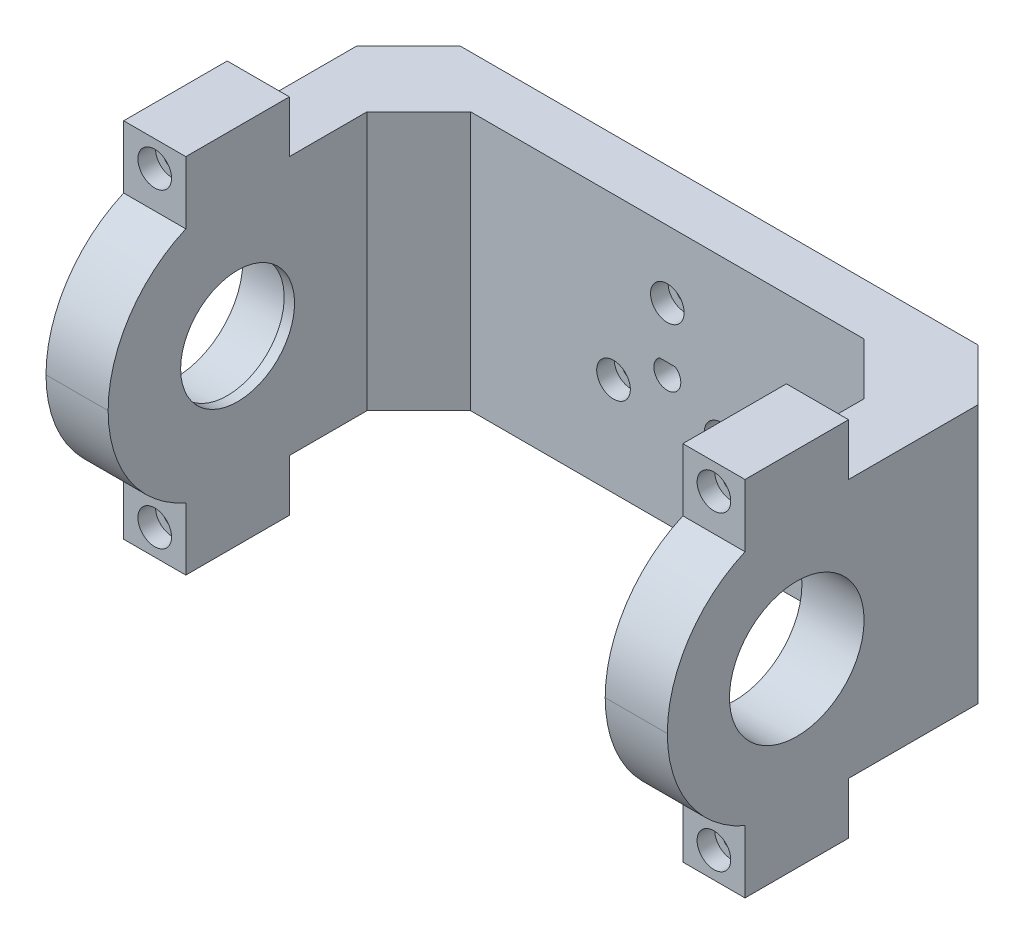
from build123d import *

# Parameters (mm, degrees)
AUFSATZ_LINEAR_AUSTRAGEN1_DEPTH            = 25
SCHNITT_LINEAR_AUSTRAGEN1_DEPTH            = 20
FASE1_SIZE                                 = 10
VERRUNDUNG1_R                              = 25
SKIZZE3_R                                  = 3.25
SCHNITT_LINEAR_AUSTRAGEN2_DEPTH            = 3.4
SKIZZE4_R                                  = 1.7
SCHNITT_LINEAR_AUSTRAGEN3_DEPTH            = 6.6
KREISMUSTER1_COUNT                         = 3
SKIZZE5_R                                  = 13
SCHNITT_LINEAR_AUSTRAGEN4_DEPTH            = 142.155942135
SKIZZE7_W                                  = 12
SKIZZE7_H                                  = 20
AUFSATZ_LINEAR_AUSTRAGEN2_DEPTH            = 10
SKIZZE9_R                                  = 1.7
SCHNITT_LINEAR_AUSTRAGEN7_DEPTH            = 78.781745931
SKIZZE8_R                                  = 3.25
SCHNITT_LINEAR_AUSTRAGEN6_DEPTH            = 3.4
SKIZZE10_R                                 = 13
SKIZZE10_R_2                               = 11
AUFSATZ_LINEAR_AUSTRAGEN3_DEPTH            = 2
SPIEGELN1_AT_THE_SECOND_PLANE_COPY_1_SKE_W = 12
SPIEGELN1_AT_THE_SECOND_PLANE_COPY_1_SKE_H = 20
SPIEGELN1_AT_THE_SECOND_PLANE_COPY_1_DEPTH = 10
SPIEGELN1_AT_THE_SECOND_PLANE_COPY_2_SKE_R = 1.7
SPIEGELN1_AT_THE_SECOND_PLANE_COPY_2_DEPTH = 78.781745931
SPIEGELN1_AT_THE_SECOND_PLANE_COPY_3_SKE_R = 3.25
SPIEGELN1_AT_THE_SECOND_PLANE_COPY_3_DEPTH = 3.4
SKIZZE11_R                                 = 1.9
SCHNITT_LINEAR_AUSTRAGEN8_DEPTH            = 10
KREISMUSTER2_COUNT                         = 4


with BuildPart() as part:
    # Skizze1 → Aufsatz-Linear austragen1 (new, symmetric)
    with BuildSketch(Plane(origin=(0, 0, 0), x_dir=(1, 0, 0), z_dir=(0, 1, 0))):
        Polygon((-60, 0), (60, 0), (60, -70), (48, -70), (48, -10), (-48, -10), (-48, -70), (-60, -70), align=None)
    extrude(amount=AUFSATZ_LINEAR_AUSTRAGEN1_DEPTH, both=True)

    # Skizze2 → Schnitt-Linear austragen1 (cut)
    with BuildSketch(Plane(origin=(0, 0, 0), x_dir=(-1, 0, 0), z_dir=(0, 0, -1))):
        with BuildLine():
            Line((-1.532970972, 2.1), (1.532970972, 2.1))
            ThreePointArc((1.532970972, 2.1), (0, -2.6), (-1.532970972, 2.1))
        make_face()
    extrude(amount=-SCHNITT_LINEAR_AUSTRAGEN1_DEPTH, mode=Mode.SUBTRACT)

    # Fase1
    fase1_edges = [part.edges().sort_by_distance(p)[0] for p in [
        (-60, 0, 0),
        (60, 0, 0),
        (48, 0, 10),
        (-48, 0, 10),
    ]]
    chamfer(fase1_edges, length=FASE1_SIZE)

    # Verrundung1
    verrundung1_edges = [part.edges().sort_by_distance(p)[0] for p in [
        (-54, -25, 70),
        (-54, 25, 70),
        (54, 25, 70),
        (54, -25, 70),
    ]]
    fillet(verrundung1_edges, radius=VERRUNDUNG1_R - 0.0001)  # a hair under: the kernel refuses the full size

    # Skizze3 → Schnitt-Linear austragen2 (cut)
    with BuildSketch(Plane.XY.offset(10)):
        with Locations((0, 12)):
            Circle(SKIZZE3_R)
    schnitt_linear_austragen2 = extrude(amount=-SCHNITT_LINEAR_AUSTRAGEN2_DEPTH, mode=Mode.SUBTRACT)

    # Skizze4 → Schnitt-Linear austragen3 (cut)
    with BuildSketch(Plane.XY.offset(6.6)):
        with Locations((0, 12)):
            Circle(SKIZZE4_R)
    schnitt_linear_austragen3 = extrude(amount=-SCHNITT_LINEAR_AUSTRAGEN3_DEPTH, mode=Mode.SUBTRACT)

    # Kreismuster1: Schnitt-Linear austragen2, Schnitt-Linear austragen3 ×3 about axis
    kreismuster1_axis = Axis((0, 0, 0), (0, 0, 1))
    add([schnitt_linear_austragen2.rotate(kreismuster1_axis, i * 360 / KREISMUSTER1_COUNT) for i in range(1, KREISMUSTER1_COUNT)], mode=Mode.SUBTRACT)
    add([schnitt_linear_austragen3.rotate(kreismuster1_axis, i * 360 / KREISMUSTER1_COUNT) for i in range(1, KREISMUSTER1_COUNT)], mode=Mode.SUBTRACT)

    # Skizze5 → Schnitt-Linear austragen4 (cut, through all)
    with BuildSketch(Plane(origin=(60, 0, 0), x_dir=(0, 0, -1), z_dir=(1, 0, 0))):
        with Locations((-45, 0)):
            Circle(SKIZZE5_R)
    extrude(amount=-SCHNITT_LINEAR_AUSTRAGEN4_DEPTH, mode=Mode.SUBTRACT)

    # Skizze7 → Aufsatz-Linear austragen2 (add, symmetric)
    with BuildSketch(Plane(origin=(0, 25, 0), x_dir=(1, 0, 0), z_dir=(0, 1, 0))):
        with Locations((-54, -45)):
            Rectangle(SKIZZE7_W, SKIZZE7_H)
    aufsatz_linear_austragen2 = extrude(amount=AUFSATZ_LINEAR_AUSTRAGEN2_DEPTH, both=True)

    # Skizze9 → Schnitt-Linear austragen7 (cut, through all)
    with BuildSketch(Plane.XY.offset(35)):
        with Locations((-54, 30)):
            Circle(SKIZZE9_R)
    schnitt_linear_austragen7 = extrude(amount=SCHNITT_LINEAR_AUSTRAGEN7_DEPTH, mode=Mode.SUBTRACT)

    # Skizze8 → Schnitt-Linear austragen6 (cut)
    with BuildSketch(Plane.XY.offset(55)):
        with Locations((-54, 30)):
            Circle(SKIZZE8_R)
    schnitt_linear_austragen6 = extrude(amount=-SCHNITT_LINEAR_AUSTRAGEN6_DEPTH, mode=Mode.SUBTRACT)

    # Skizze10 → Aufsatz-Linear austragen3 (add)
    with BuildSketch(Plane.ZY.offset(48)):
        with Locations(Location((45, 0, 0), (0, 0, 180))):
            Circle(SKIZZE10_R)
        with Locations((45, 0)):
            Circle(SKIZZE10_R_2, mode=Mode.SUBTRACT)
    extrude(amount=AUFSATZ_LINEAR_AUSTRAGEN3_DEPTH)

    # Spiegeln1: Aufsatz-Linear austragen2, Schnitt-Linear austragen7, Schnitt-Linear austragen6 across plane
    add(aufsatz_linear_austragen2.mirror(Plane(origin=(0, 0, 0), x_dir=(0, 0, 1), z_dir=(1, 0, 0))))
    add(schnitt_linear_austragen7.mirror(Plane(origin=(0, 0, 0), x_dir=(0, 0, 1), z_dir=(1, 0, 0))), mode=Mode.SUBTRACT)
    add(schnitt_linear_austragen6.mirror(Plane(origin=(0, 0, 0), x_dir=(0, 0, 1), z_dir=(1, 0, 0))), mode=Mode.SUBTRACT)

    # Spiegeln1 at the second plane: Aufsatz-Linear austragen2, Schnitt-Linear austragen7, Schnitt-Linear austragen6 across plane
    add(aufsatz_linear_austragen2.mirror(Plane.ZX))
    add(schnitt_linear_austragen7.mirror(Plane.ZX), mode=Mode.SUBTRACT)
    add(schnitt_linear_austragen6.mirror(Plane.ZX), mode=Mode.SUBTRACT)

    # Spiegeln1 at the second plane copy 1 ske → Spiegeln1 at the second plane copy 1 (add, symmetric)
    with BuildSketch(Plane(origin=(0, -25, 0), x_dir=(-1, 0, 0), z_dir=(0, -1, 0))):
        with Locations((-54, -45)):
            Rectangle(SPIEGELN1_AT_THE_SECOND_PLANE_COPY_1_SKE_W, SPIEGELN1_AT_THE_SECOND_PLANE_COPY_1_SKE_H)
    extrude(amount=SPIEGELN1_AT_THE_SECOND_PLANE_COPY_1_DEPTH, both=True)

    # Spiegeln1 at the second plane copy 2 ske → Spiegeln1 at the second plane copy 2 (cut, through all)
    with BuildSketch(Plane(origin=(0, 0, 35), x_dir=(-1, 0, 0), z_dir=(0, 0, 1))):
        with Locations((-54, 30)):
            Circle(SPIEGELN1_AT_THE_SECOND_PLANE_COPY_2_SKE_R)
    extrude(amount=SPIEGELN1_AT_THE_SECOND_PLANE_COPY_2_DEPTH, mode=Mode.SUBTRACT)

    # Spiegeln1 at the second plane copy 3 ske → Spiegeln1 at the second plane copy 3 (cut)
    with BuildSketch(Plane(origin=(0, 0, 55), x_dir=(-1, 0, 0), z_dir=(0, 0, 1))):
        with Locations((-54, 30)):
            Circle(SPIEGELN1_AT_THE_SECOND_PLANE_COPY_3_SKE_R)
    extrude(amount=-SPIEGELN1_AT_THE_SECOND_PLANE_COPY_3_DEPTH, mode=Mode.SUBTRACT)

    # Skizze11 → Schnitt-Linear austragen8 (cut)
    with BuildSketch(Plane(origin=(-60, 0, 0), x_dir=(0, 0, -1), z_dir=(1, 0, 0))):
        with Locations((-62.5, 0)):
            Circle(SKIZZE11_R)
    schnitt_linear_austragen8 = extrude(amount=SCHNITT_LINEAR_AUSTRAGEN8_DEPTH, mode=Mode.SUBTRACT)

    # Kreismuster2: Schnitt-Linear austragen8 ×4 about axis
    kreismuster2_axis = Axis((0, 0, 45), (1, 0, 0))
    for i in range(1, KREISMUSTER2_COUNT):
        add(schnitt_linear_austragen8.rotate(kreismuster2_axis, i * 360 / KREISMUSTER2_COUNT), mode=Mode.SUBTRACT)


solid = part.part
